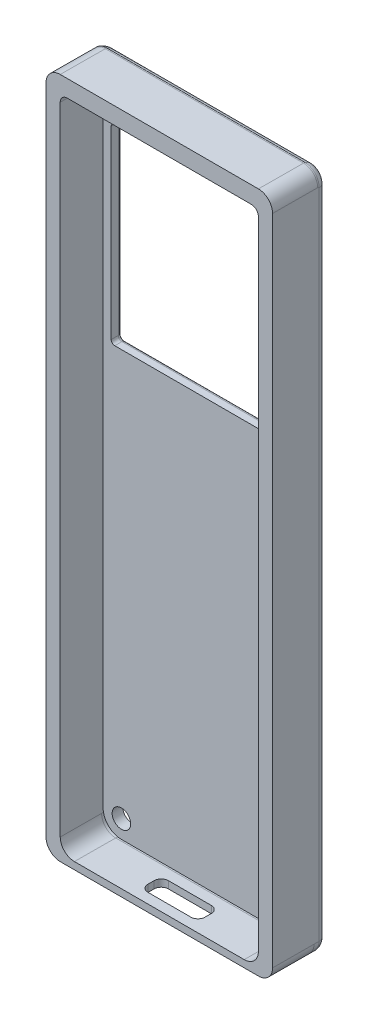
from build123d import *

# Parameters (mm, degrees)
BOSS_EXTRU_1_DEPTH      = 1.5
ESQUISSE2_R             = 1.304771715
ESQUISSE2_R_2           = 1.27
ENL_V_MAT_EXTRU_1_DEPTH = 10
ESQUISSE3_R             = 1.3
ENL_V_MAT_EXTRU_2_DEPTH = 10
BOSS_EXTRU_2_START      = -1
ESQUISSE4_R             = 1.3
ESQUISSE4_R_2           = 1.304771715
BOSS_EXTRU_2_DEPTH      = 1
ESQUISSE5_W             = 25.676080865
ESQUISSE5_H             = 27.053553015
ENL_V_MAT_EXTRU_3_DEPTH = 10
CONG_1_R                = 0.5
CONG_2_R                = 0.5
BOSS_EXTRU_3_REACH      = 171.856
BOSS_EXTRU_4_DEPTH      = 0.1
BOSS_EXTRU_5_REACH      = 171.861
CONG_3_R                = 1
ENL_V_MAT_EXTRU_4_DEPTH = 10


with BuildPart() as part:
    # Model → Boss.-Extru.1 (new body)
    with BuildSketch(Plane.XY):
        with BuildLine():
            Line((110.49, -34.813931), (110.49, -38.623931))
            Line((110.49, -38.623931), (110.49, -39.893931))
            Line((110.49, -39.893931), (110.49, -123.713931))
            add(Edge.make_bspline(
                [(109.746051, -125.509982), (110.222394, -125.03364), (110.49, -124.387581), (110.49, -123.713931)],
                knots=[0, 0, 0, 0, 1, 1, 1, 1], degree=3))
            add(Edge.make_bspline(
                [(107.95, -126.253931), (108.62365, -126.253931), (109.269709, -125.986325), (109.746051, -125.509982)],
                knots=[0, 0, 0, 0, 1, 1, 1, 1], degree=3))
            Line((107.95, -126.253931), (85.09, -126.253931))
            add(Edge.make_bspline(
                [(83.293949, -125.509982), (83.770291, -125.986325), (84.41635, -126.253931), (85.09, -126.253931)],
                knots=[0, 0, 0, 0, 1, 1, 1, 1], degree=3))
            add(Edge.make_bspline(
                [(82.55, -123.713931), (82.55, -124.387581), (82.817606, -125.03364), (83.293949, -125.509982)],
                knots=[0, 0, 0, 0, 1, 1, 1, 1], degree=3))
            Line((82.55, -123.713931), (82.55, -39.893931))
            Line((82.55, -39.893931), (82.55, -38.623931))
            Line((82.55, -38.623931), (82.55, -34.813931))
            add(Edge.make_bspline(
                [(82.921974, -33.915905), (82.683803, -34.154076), (82.55, -34.477106), (82.55, -34.813931)],
                knots=[0, 0, 0, 0, 1, 1, 1, 1], degree=3))
            add(Edge.make_bspline(
                [(83.82, -33.543931), (83.483175, -33.543931), (83.160146, -33.677734), (82.921974, -33.915905)],
                knots=[0, 0, 0, 0, 1, 1, 1, 1], degree=3))
            Line((83.82, -33.543931), (109.22, -33.543931))
            add(Edge.make_bspline(
                [(110.118026, -33.915905), (109.879854, -33.677734), (109.556825, -33.543931), (109.22, -33.543931)],
                knots=[0, 0, 0, 0, 1, 1, 1, 1], degree=3))
            add(Edge.make_bspline(
                [(110.49, -34.813931), (110.49, -34.477106), (110.356197, -34.154076), (110.118026, -33.915905)],
                knots=[0, 0, 0, 0, 1, 1, 1, 1], degree=3))
        make_face()
    extrude(amount=BOSS_EXTRU_1_DEPTH)

    # Esquisse2 → Enlèv. mat.-Extru.1 (cut)
    with BuildSketch(Plane.XY.offset(1.5)):
        with Locations((85.124771715, -123.713931)):
            Circle(ESQUISSE2_R)
        with Locations((107.95, -123.713931)):
            Circle(ESQUISSE2_R_2)
    extrude(amount=-ENL_V_MAT_EXTRU_1_DEPTH, mode=Mode.SUBTRACT)

    # Esquisse3 → Enlèv. mat.-Extru.2 (cut)
    with BuildSketch(Plane.XY.offset(1.5)):
        with Locations((107.943434753, -36.148574536)):
            Circle(ESQUISSE3_R)
        with Locations((85.084137325, -36.091280874)):
            Circle(ESQUISSE3_R)
    extrude(amount=-ENL_V_MAT_EXTRU_2_DEPTH, mode=Mode.SUBTRACT)

    # Esquisse4 → Boss.-Extru.2 (add)
    with BuildSketch(Plane(origin=(0, 0, 0), x_dir=(-1, 0, 0), z_dir=(0, 0, -1)).offset(BOSS_EXTRU_2_START)):
        with BuildLine():
            Line((-80.55, -33.263931), (-80.55, -125.263931))
            ThreePointArc((-80.55, -125.263931), (-81.135786438, -126.678144562), (-82.55, -127.263931))
            Line((-82.55, -127.263931), (-110.49, -127.263931))
            ThreePointArc((-110.49, -127.263931), (-111.904213562, -126.678144562), (-112.49, -125.263931))
            Line((-112.49, -125.263931), (-112.49, -33.263931))
            ThreePointArc((-112.49, -33.263931), (-111.904213562, -31.849717438), (-110.49, -31.263931))
            Line((-110.49, -31.263931), (-82.55, -31.263931))
            ThreePointArc((-82.55, -31.263931), (-81.135786438, -31.849717438), (-80.55, -33.263931))
        make_face()
        with Locations(Location((-107.943434753, -36.148574536, 0), (0, 0, 180))):
            Circle(ESQUISSE4_R, mode=Mode.SUBTRACT)
        with Locations(Location((-85.084137325, -36.091280874, 0), (0, 0, 180))):
            Circle(ESQUISSE4_R, mode=Mode.SUBTRACT)
        with Locations((-107.95, -123.713931)):
            Circle(ESQUISSE4_R, mode=Mode.SUBTRACT)
        with Locations(Location((-85.124771715, -123.713931, 0), (0, 0, 180))):
            Circle(ESQUISSE4_R_2, mode=Mode.SUBTRACT)
    extrude(amount=BOSS_EXTRU_2_DEPTH)

    # Esquisse5 → Enlèv. mat.-Extru.3 (cut)
    with BuildSketch(Plane(origin=(0, 0, 0), x_dir=(-1, 0, 0), z_dir=(0, 0, -1))):
        with Locations((-96.524770843, -52.916284218)):
            Rectangle(ESQUISSE5_W, ESQUISSE5_H)
    extrude(amount=-ENL_V_MAT_EXTRU_3_DEPTH, mode=Mode.SUBTRACT)

    # Congé1
    cong_1_edges = [part.edges().sort_by_distance(p)[0] for p in [
        (109.362811276, -66.443060725, 0.75),
        (109.362811276, -39.38950771, 0.75),
        (83.686730411, -39.38950771, 0.75),
        (83.686730411, -66.443060725, 0.75),
    ]]
    fillet(cong_1_edges, radius=CONG_1_R)

    # Congé2
    cong_2_edges = [part.edges().sort_by_distance(p)[0] for p in [
        (83.686730411, -52.916284217, 0),
        (96.524770843, -66.443060725, 0),
        (109.362811276, -52.916284217, 0),
        (96.524770843, -39.38950771, 0),
        (83.83317702, -66.296614115, 0),
        (109.216364666, -66.296614115, 0),
        (83.83317702, -39.53595432, 0),
        (109.216364666, -39.53595432, 0),
    ]]
    fillet(cong_2_edges, radius=CONG_2_R)

    # Boss.-Extru.3: up to this plane
    boss_extru_3_end = Plane(origin=(151.945719344, 11.006581477, 0.949399472), z_dir=(0, 0.00563171546098114, 0.9999841417647415))
    # Esquisse6 → Boss.-Extru.3 (add, up to the surface)
    with BuildSketch(Plane.XY.offset(1), mode=Mode.PRIVATE) as boss_extru_3_sk1:
        with BuildLine():
            Line((110.49, -31.152890146), (82.55, -31.152890146))
            ThreePointArc((82.55, -31.152890146), (81.135786438, -31.738676584), (80.55, -33.152890146))
            Line((80.55, -33.152890146), (80.55, -125.263931))
            ThreePointArc((80.55, -125.263931), (81.135786438, -126.678144562), (82.55, -127.263931))
            Line((82.55, -127.263931), (110.49, -127.263931))
            ThreePointArc((110.49, -127.263931), (111.904213562, -126.678144562), (112.49, -125.263931))
            Line((112.49, -125.263931), (112.49, -33.152890146))
            ThreePointArc((112.49, -33.152890146), (111.904213562, -31.738676584), (110.49, -31.152890146))
        make_face()
        with BuildLine():
            Line((109.49, -33.543931), (83.55, -33.543931))
            ThreePointArc((83.55, -33.543931), (82.842893219, -33.836824219), (82.55, -34.543931))
            Line((82.55, -34.543931), (82.55, -124.253931))
            ThreePointArc((82.55, -124.253931), (83.135786438, -125.668144562), (84.55, -126.253931))
            Line((84.55, -126.253931), (108.49, -126.253931))
            ThreePointArc((108.49, -126.253931), (109.904213562, -125.668144562), (110.49, -124.253931))
            Line((110.49, -124.253931), (110.49, -34.543931))
            ThreePointArc((110.49, -34.543931), (110.197106781, -33.836824219), (109.49, -33.543931))
        make_face(mode=Mode.SUBTRACT)
    boss_extru_3_tool1 = split(extrude(boss_extru_3_sk1.sketch, amount=BOSS_EXTRU_3_REACH, mode=Mode.PRIVATE), bisect_by=boss_extru_3_end, keep=Keep.BOTH, mode=Mode.PRIVATE)
    add(boss_extru_3_tool1.solids().sort_by_distance((96.52, -32.165683, 1))[0])

    # Esquisse8 → Boss.-Extru.4 (add)
    # profile 1 of 11: a face of its own
    with BuildSketch(Plane(origin=(0, 0, 0), x_dir=(-1, 0, 0), z_dir=(0, 0, -1))):
        Polygon((-106.7274706, -118.903119939), (-107.040908875, -118.903119939), (-107.076684624, -117.40801403), (-107.092169649, -116.871377801), (-107.203768626, -117.190689706), (-107.556720414, -118.151295253), (-107.778850434, -118.151295253), (-108.1099096, -117.226999421), (-108.219906678, -116.871377801), (-108.227382207, -117.433644417), (-108.271167452, -118.903119939), (-108.573926398, -118.903119939), (-108.456453791, -116.545124333), (-108.075735751, -116.545124333), (-107.758559711, -117.458206871), (-107.656038163, -117.766305481), (-107.555118514, -117.458206871), (-107.216583819, -116.545124333), (-106.825720417, -116.545124333), align=None)
    # profile 2 of 11: a face of its own
    with BuildSketch(Plane(origin=(0, 0, 0), x_dir=(-1, 0, 0), z_dir=(0, 0, -1))):
        with BuildLine():
            add(Edge.make_bspline(
                [(-104.717087119, -117.708637111), (-104.717973323, -117.759932969), (-104.719684596, -117.858985991), (-104.733780583, -118.00210291), (-104.75613314, -118.134577406), (-104.788745518, -118.256201652), (-104.82968214, -118.366950931), (-104.875882023, -118.46828329), (-104.929331795, -118.559391304), (-104.989204836, -118.640612659), (-105.055370399, -118.711245231), (-105.126089732, -118.773336103), (-105.203705016, -118.823782996), (-105.285420912, -118.865736696), (-105.371222576, -118.897596699), (-105.459543146, -118.920769872), (-105.550370869, -118.934285727), (-105.611615452, -118.936286459), (-105.642450883, -118.937293788)],
                knots=[0, 0, 0, 0, 1.423082774, 2.747992794, 3.986236128, 5.147128242, 6.236197569, 7.259302453, 8.233395673, 9.161912359, 10.053001658, 10.914402565, 11.766421957, 12.614596425, 13.458547256, 14.300675266, 15.144423756, 16, 16, 16, 16], degree=3))
            add(Edge.make_bspline(
                [(-105.642450883, -118.937293788), (-105.678820327, -118.936301062), (-105.749414471, -118.934374152), (-105.851677603, -118.918543), (-105.946771414, -118.893189924), (-106.03478415, -118.857208397), (-106.115027686, -118.810923688), (-106.188691252, -118.756039481), (-106.254604423, -118.691317795), (-106.31354804, -118.617816502), (-106.365061943, -118.535262828), (-106.409125711, -118.444174544), (-106.446586662, -118.344799531), (-106.476761918, -118.237201029), (-106.5000698, -118.121877477), (-106.516217849, -117.999302966), (-106.526737781, -117.869901201), (-106.527771485, -117.781278098), (-106.528301135, -117.735869397)],
                knots=[0, 0, 0, 0, 1.030115455, 1.999483942, 2.924432069, 3.813267415, 4.685316872, 5.542716903, 6.40939724, 7.295524004, 8.206506083, 9.160640047, 10.158252241, 11.211975818, 12.323750963, 13.4892538, 14.713543989, 16, 16, 16, 16], degree=3))
            add(Edge.make_bspline(
                [(-106.528301135, -117.735869397), (-106.527342849, -117.685114184), (-106.525490017, -117.586979601), (-106.512310078, -117.444856037), (-106.489638833, -117.313200606), (-106.457597105, -117.191936676), (-106.417461995, -117.08115519), (-106.370932574, -116.980166743), (-106.318462135, -116.888740986), (-106.258096455, -116.808151535), (-106.192022817, -116.737307321), (-106.121228503, -116.675393605), (-106.04430796, -116.624302361), (-105.963034704, -116.582406725), (-105.87751773, -116.550759341), (-105.789426583, -116.527393141), (-105.698751459, -116.51397278), (-105.63750933, -116.51196258), (-105.606675135, -116.510950484)],
                knots=[0, 0, 0, 0, 1.41309666, 2.732205102, 3.969807196, 5.128608405, 6.219709524, 7.24631839, 8.221244419, 9.148965463, 10.043106611, 10.914447659, 11.761129373, 12.607796584, 13.454637821, 14.294855332, 15.141493535, 16, 16, 16, 16], degree=3))
            add(Edge.make_bspline(
                [(-105.606675135, -116.510950484), (-105.570311777, -116.511973749), (-105.499553435, -116.513964889), (-105.397158122, -116.529416787), (-105.302158873, -116.555700263), (-105.214466557, -116.592191645), (-105.133822192, -116.638433659), (-105.06031483, -116.693706604), (-104.993764776, -116.757948396), (-104.935234932, -116.831577637), (-104.883088538, -116.913582734), (-104.837610616, -117.003772306), (-104.800602356, -117.103027178), (-104.769604142, -117.209920374), (-104.74595447, -117.324583201), (-104.728962319, -117.446395308), (-104.718702603, -117.575145541), (-104.717634463, -117.663408691), (-104.717087119, -117.708637111)],
                knots=[0, 0, 0, 0, 1.031800753, 2.007749398, 2.930678117, 3.822900438, 4.696376593, 5.562252438, 6.426830471, 7.314406963, 8.225311853, 9.18096675, 10.175487812, 11.227471919, 12.337140194, 13.495232744, 14.716489688, 16, 16, 16, 16], degree=3))
        make_face()
        with BuildLine():
            add(Edge.make_bspline(
                [(-105.058825612, -117.731597666), (-105.059342426, -117.697420919), (-105.060355144, -117.630450239), (-105.065140992, -117.532201597), (-105.075838982, -117.438587016), (-105.088656952, -117.349545514), (-105.106003142, -117.26558414), (-105.12858023, -117.187504846), (-105.15481233, -117.114985474), (-105.186996831, -117.049023604), (-105.223838826, -116.989621224), (-105.265044626, -116.936266326), (-105.312269553, -116.89098489), (-105.364080041, -116.852358718), (-105.421140006, -116.821570902), (-105.483944247, -116.799480835), (-105.5523991, -116.786640183), (-105.599856339, -116.785122738), (-105.624296026, -116.784341279)],
                knots=[0, 0, 0, 0, 1.323673599, 2.593790554, 3.807090586, 4.970987518, 6.076778004, 7.123914636, 8.116191169, 9.059475772, 9.960330598, 10.819370074, 11.662669578, 12.485668992, 13.315223066, 14.163241623, 15.054100047, 16, 16, 16, 16], degree=3))
            add(Edge.make_bspline(
                [(-105.624296026, -116.784341279), (-105.648022301, -116.785328797), (-105.694262926, -116.787253392), (-105.761352028, -116.800376834), (-105.82278306, -116.82434556), (-105.878941165, -116.856840282), (-105.929888479, -116.897099814), (-105.975337968, -116.945005311), (-106.017301598, -116.998246897), (-106.053669209, -117.0586763), (-106.084522833, -117.125098521), (-106.113021479, -117.196485788), (-106.135132929, -117.273967226), (-106.15469774, -117.356000534), (-106.168701111, -117.442241806), (-106.178629982, -117.531361124), (-106.18542878, -117.623098493), (-106.186180642, -117.685130147), (-106.186562641, -117.716646606)],
                knots=[0, 0, 0, 0, 0.938104053, 1.828290259, 2.688226573, 3.533173995, 4.38495139, 5.245952462, 6.138444459, 7.060521377, 8.026891732, 9.031849607, 10.096184638, 11.209149641, 12.36492099, 13.547735175, 14.754076334, 16, 16, 16, 16], degree=3))
            add(Edge.make_bspline(
                [(-106.186562641, -117.716646606), (-106.186142779, -117.751186029), (-106.185324072, -117.818536006), (-106.179221857, -117.917393631), (-106.170005302, -118.011532224), (-106.156142205, -118.100852546), (-106.13827359, -118.184566879), (-106.115826789, -118.262383655), (-106.089257937, -118.334312257), (-106.05804278, -118.400186866), (-106.021398332, -118.459345555), (-105.980554845, -118.512386765), (-105.933304026, -118.55714907), (-105.882743451, -118.596585947), (-105.825545494, -118.626644298), (-105.763390128, -118.648630866), (-105.695494363, -118.661660421), (-105.648560269, -118.663138729), (-105.624296026, -118.663902993)],
                knots=[0, 0, 0, 0, 1.340540585, 2.613980496, 3.843097936, 5.010722051, 6.120504555, 7.163418743, 8.151508278, 9.093960035, 9.987380757, 10.848401497, 11.683877306, 12.507385072, 13.329500698, 14.179475102, 15.05881515, 16, 16, 16, 16], degree=3))
            add(Edge.make_bspline(
                [(-105.624296026, -118.663902993), (-105.600548631, -118.663007986), (-105.554405284, -118.661268907), (-105.487803999, -118.646938667), (-105.42610608, -118.623962589), (-105.369675883, -118.591376301), (-105.318210564, -118.551152031), (-105.272165071, -118.503422931), (-105.230246619, -118.4498564), (-105.193446174, -118.38946367), (-105.16110685, -118.323440097), (-105.133287921, -118.251756787), (-105.109832374, -118.175025444), (-105.091586822, -118.092982883), (-105.076435635, -118.007149223), (-105.066799323, -117.917761649), (-105.059945755, -117.825682253), (-105.059202969, -117.76329309), (-105.058825612, -117.731597666)],
                knots=[0, 0, 0, 0, 0.936906737, 1.820494917, 2.676828052, 3.526792157, 4.383009914, 5.247809723, 6.13916262, 7.06372975, 8.034989121, 9.038664354, 10.096936984, 11.200050273, 12.355522744, 13.536827286, 14.74863997, 16, 16, 16, 16], degree=3))
        make_face(mode=Mode.SUBTRACT)
    # profile 3 of 11: a face of its own
    with BuildSketch(Plane(origin=(0, 0, 0), x_dir=(-1, 0, 0), z_dir=(0, 0, -1))):
        with BuildLine():
            Line((-102.735003856, -118.903119939), (-103.097033073, -118.903119939))
            Line((-103.097033073, -118.903119939), (-103.436101734, -118.166780278))
            add(Edge.make_bspline(
                [(-103.436101734, -118.166780278), (-103.448353709, -118.140674339), (-103.471082644, -118.09224458), (-103.511101792, -118.028652217), (-103.552550516, -117.977416075), (-103.597448894, -117.93802618), (-103.646431584, -117.909289447), (-103.6998089, -117.890697287), (-103.758355175, -117.879889712), (-103.799149565, -117.878587716), (-103.82055754, -117.877904458)],
                knots=[0, 0, 0, 0, 1.339134837, 2.484261414, 3.482991323, 4.391871607, 5.244507385, 6.105289549, 7.005698766, 8, 8, 8, 8], degree=3))
            Line((-103.82055754, -117.877904458), (-103.965262433, -117.877904458))
            Line((-103.965262433, -117.877904458), (-103.965262433, -118.903119939))
            Line((-103.965262433, -118.903119939), (-104.307000927, -118.903119939))
            Line((-104.307000927, -118.903119939), (-104.307000927, -116.545124333))
            Line((-104.307000927, -116.545124333), (-103.680124377, -116.545124333))
            add(Edge.make_bspline(
                [(-103.680124377, -116.545124333), (-103.647175533, -116.545551224), (-103.58364941, -116.54637428), (-103.491923742, -116.555050704), (-103.407370634, -116.569047536), (-103.33012045, -116.589525195), (-103.25964968, -116.614547384), (-103.195716824, -116.644449401), (-103.138313159, -116.679057937), (-103.087657987, -116.718546569), (-103.042877129, -116.761640536), (-103.005297417, -116.809911085), (-102.973430428, -116.861903323), (-102.948421069, -116.91841), (-102.929458174, -116.978315409), (-102.915303437, -117.041335568), (-102.907400955, -117.107543277), (-102.906387961, -117.152758064), (-102.905873103, -117.175738647)],
                knots=[0, 0, 0, 0, 1.390037284, 2.680023546, 3.883960013, 5.002565466, 6.047913656, 7.03574216, 7.976084698, 8.870016629, 9.741095147, 10.591561451, 11.444313202, 12.308368875, 13.191986167, 14.092206828, 15.030357037, 16, 16, 16, 16], degree=3))
            add(Edge.make_bspline(
                [(-102.905873103, -117.175738647), (-102.906299828, -117.194266936), (-102.907139036, -117.230705107), (-102.913307317, -117.284580468), (-102.922647141, -117.336975007), (-102.936641725, -117.387646073), (-102.954289554, -117.436396149), (-102.975602993, -117.483186645), (-103.001467244, -117.527500943), (-103.030744324, -117.569800653), (-103.06405647, -117.609402655), (-103.100846671, -117.646440402), (-103.141994725, -117.680044269), (-103.185911355, -117.711618064), (-103.233797749, -117.739554511), (-103.285169987, -117.76342455), (-103.33976665, -117.783958571), (-103.377802356, -117.794206216), (-103.397122188, -117.799411398)],
                knots=[0, 0, 0, 0, 1.032708305, 2.030948508, 3.019625047, 3.996933367, 4.957424013, 5.907556856, 6.85893238, 7.814077788, 8.77200233, 9.740252168, 10.719774328, 11.730219428, 12.753012585, 13.805036997, 14.885091985, 16, 16, 16, 16], degree=3))
            add(Edge.make_bspline(
                [(-103.397122188, -117.799411398), (-103.381419157, -117.805170922), (-103.350263296, -117.816598203), (-103.307426399, -117.842045509), (-103.267136699, -117.871624361), (-103.231902439, -117.90942604), (-103.197452701, -117.95200387), (-103.163304596, -118.001064798), (-103.128627713, -118.056429621), (-103.106790799, -118.096353097), (-103.095431174, -118.117121404)],
                knots=[0, 0, 0, 0, 0.890820497, 1.767447404, 2.649001527, 3.549193506, 4.515009134, 5.571837998, 6.736863216, 8, 8, 8, 8], degree=3))
            Line((-103.095431174, -118.117121404), (-102.735003856, -118.903119939))
        make_face()
        with BuildLine():
            add(Edge.make_bspline(
                [(-103.247611597, -117.198699202), (-103.2478616, -117.183198772), (-103.248345994, -117.15316598), (-103.253707439, -117.10969252), (-103.262881778, -117.069329593), (-103.275102823, -117.031927507), (-103.290371722, -116.997133872), (-103.310621918, -116.966147864), (-103.333478809, -116.937638608), (-103.359880656, -116.912352606), (-103.389614394, -116.890355675), (-103.422283739, -116.871237542), (-103.457585816, -116.854570623), (-103.495866099, -116.841119789), (-103.53707523, -116.831286059), (-103.581098333, -116.823619114), (-103.628075081, -116.819543005), (-103.660360788, -116.818863603), (-103.676920579, -116.818515128)],
                knots=[0, 0, 0, 0, 1.136086502, 2.201219443, 3.204852043, 4.166451082, 5.083443327, 5.98129036, 6.87199526, 7.758098985, 8.653381414, 9.577773354, 10.529401831, 11.511765708, 12.546811162, 13.632454437, 14.78565276, 16, 16, 16, 16], degree=3))
            Line((-103.676920579, -116.818515128), (-103.965262433, -116.818515128))
            Line((-103.965262433, -116.818515128), (-103.965262433, -117.604513663))
            Line((-103.965262433, -117.604513663), (-103.718035992, -117.604513663))
            add(Edge.make_bspline(
                [(-103.718035992, -117.604513663), (-103.70040781, -117.60419861), (-103.66597293, -117.603583185), (-103.615741009, -117.599018791), (-103.568418143, -117.590013906), (-103.523534793, -117.579364835), (-103.48174396, -117.564261641), (-103.44325952, -117.545989502), (-103.407433851, -117.525301617), (-103.375551145, -117.500462291), (-103.346319226, -117.473148575), (-103.320735139, -117.442655718), (-103.298479026, -117.409258647), (-103.280510266, -117.372501826), (-103.265165543, -117.333207592), (-103.255507971, -117.290540611), (-103.248702183, -117.245550799), (-103.247980981, -117.214567969), (-103.247611597, -117.198699202)],
                knots=[0, 0, 0, 0, 1.202615583, 2.349188572, 3.435207305, 4.486530095, 5.492783739, 6.45958443, 7.390413995, 8.308405015, 9.210274755, 10.115082188, 11.017605575, 11.940721498, 12.901403136, 13.887978084, 14.918265918, 16, 16, 16, 16], degree=3))
        make_face(mode=Mode.SUBTRACT)
    # profile 4 of 11: a face of its own
    with BuildSketch(Plane(origin=(0, 0, 0), x_dir=(-1, 0, 0), z_dir=(0, 0, -1))):
        with BuildLine():
            add(Edge.make_bspline(
                [(-100.787094443, -117.26277517), (-100.787671496, -117.286662222), (-100.788830791, -117.334651104), (-100.799533367, -117.406293022), (-100.816106249, -117.477551035), (-100.838872373, -117.547956571), (-100.868729297, -117.616469517), (-100.906038993, -117.681868638), (-100.951647519, -117.742925399), (-101.003240573, -117.800939683), (-101.062893975, -117.853962856), (-101.130322341, -117.901737196), (-101.205334691, -117.944269855), (-101.287705951, -117.982118357), (-101.378515906, -118.011819572), (-101.477512624, -118.033860045), (-101.58504789, -118.046462557), (-101.659562544, -118.047986669), (-101.698041115, -118.048773705)],
                knots=[0, 0, 0, 0, 0.84837333, 1.704374698, 2.568122001, 3.446177459, 4.329841521, 5.219461111, 6.115085959, 7.03322926, 7.973947317, 8.94447037, 9.964314875, 11.034235969, 12.160282575, 13.352588404, 14.632904974, 16, 16, 16, 16], degree=3))
            Line((-101.698041115, -118.048773705), (-101.98317917, -118.048773705))
            Line((-101.98317917, -118.048773705), (-101.98317917, -118.903119939))
            Line((-101.98317917, -118.903119939), (-102.324917664, -118.903119939))
            Line((-102.324917664, -118.903119939), (-102.324917664, -116.545124333))
            Line((-102.324917664, -116.545124333), (-101.665469165, -116.545124333))
            add(Edge.make_bspline(
                [(-101.665469165, -116.545124333), (-101.636793461, -116.545428032), (-101.579874842, -116.546030846), (-101.495600127, -116.554100669), (-101.412955245, -116.565468811), (-101.332613, -116.582463749), (-101.255467213, -116.604760217), (-101.182175586, -116.631975711), (-101.114762499, -116.667473107), (-101.051459666, -116.707250069), (-100.993159593, -116.75316763), (-100.941870853, -116.806454354), (-100.896636584, -116.865816475), (-100.857459781, -116.931114436), (-100.825203818, -117.003454505), (-100.803525355, -117.083606193), (-100.788972064, -117.170760752), (-100.787734991, -117.231384562), (-100.787094443, -117.26277517)],
                knots=[0, 0, 0, 0, 1.071095419, 2.126025337, 3.160633674, 4.187194637, 5.191188192, 6.159546808, 7.102471747, 8.032359578, 8.950543616, 9.867691343, 10.788184798, 11.733733012, 12.707489344, 13.737062018, 14.82826569, 16, 16, 16, 16], degree=3))
        make_face()
        with BuildLine():
            add(Edge.make_bspline(
                [(-101.128832937, -117.280930027), (-101.12917383, -117.26275083), (-101.129838245, -117.227318897), (-101.136980352, -117.176006529), (-101.148227151, -117.127907754), (-101.163546919, -117.083064255), (-101.183406884, -117.041342548), (-101.208239381, -117.003313356), (-101.237257648, -116.968182954), (-101.270953323, -116.936779885), (-101.308664349, -116.909137286), (-101.349258743, -116.884150077), (-101.39404529, -116.863958261), (-101.442407784, -116.847589722), (-101.494079143, -116.833982688), (-101.549560356, -116.825419538), (-101.608187398, -116.819061494), (-101.648541165, -116.818700169), (-101.66920693, -116.818515128)],
                knots=[0, 0, 0, 0, 1.07893025, 2.102875295, 3.069403633, 4.00867391, 4.911619206, 5.805799344, 6.69897942, 7.61127936, 8.532960211, 9.47193309, 10.436783978, 11.442898866, 12.50165651, 13.605056338, 14.773513735, 16, 16, 16, 16], degree=3))
            Line((-101.66920693, -116.818515128), (-101.98317917, -116.818515128))
            Line((-101.98317917, -116.818515128), (-101.98317917, -117.77538291))
            Line((-101.98317917, -117.77538291), (-101.696439216, -117.77538291))
            add(Edge.make_bspline(
                [(-101.696439216, -117.77538291), (-101.674358783, -117.774903991), (-101.631556628, -117.773975623), (-101.569078835, -117.76877243), (-101.510444058, -117.759413572), (-101.455918111, -117.745335439), (-101.405266263, -117.728338417), (-101.35839808, -117.707576016), (-101.315555203, -117.682289164), (-101.27640127, -117.653466655), (-101.241206277, -117.620832055), (-101.21131346, -117.583507568), (-101.185444263, -117.542794003), (-101.164416766, -117.497953903), (-101.14867792, -117.449070519), (-101.136863575, -117.396556925), (-101.129838661, -117.340034991), (-101.129175519, -117.301063119), (-101.128832937, -117.280930027)],
                knots=[0, 0, 0, 0, 1.232805628, 2.389751021, 3.4973379, 4.54330244, 5.530003372, 6.477393866, 7.399377973, 8.301660217, 9.187431021, 10.070466494, 10.963674817, 11.874940633, 12.827061481, 13.825105319, 14.876436953, 16, 16, 16, 16], degree=3))
        make_face(mode=Mode.SUBTRACT)
    # profile 5 of 11: a face of its own
    with BuildSketch(Plane(origin=(0, 0, 0), x_dir=(-1, 0, 0), z_dir=(0, 0, -1))):
        Polygon((-98.736663482, -118.903119939), (-99.078401975, -118.903119939), (-99.078401975, -117.809556759), (-100.035269757, -117.809556759), (-100.035269757, -118.903119939), (-100.377008251, -118.903119939), (-100.377008251, -116.545124333), (-100.035269757, -116.545124333), (-100.035269757, -117.536165965), (-99.078401975, -117.536165965), (-99.078401975, -116.545124333), (-98.736663482, -116.545124333), align=None)
    # profile 6 of 11: a face of its own
    with BuildSketch(Plane(origin=(0, 0, 0), x_dir=(-1, 0, 0), z_dir=(0, 0, -1))):
        Polygon((-96.857101767, -118.903119939), (-98.189881892, -118.903119939), (-98.189881892, -116.545124333), (-96.857101767, -116.545124333), (-96.857101767, -116.818515128), (-97.848143399, -116.818515128), (-97.848143399, -117.536165965), (-96.896615281, -117.536165965), (-96.896615281, -117.809556759), (-97.848143399, -117.809556759), (-97.848143399, -118.629729144), (-96.857101767, -118.629729144), align=None)
    # profile 7 of 11: a face of its own
    with BuildSketch(Plane(origin=(0, 0, 0), x_dir=(-1, 0, 0), z_dir=(0, 0, -1))):
        with BuildLine():
            add(Edge.make_bspline(
                [(-94.738323107, -118.265030095), (-94.739090488, -118.292314491), (-94.740579195, -118.345245759), (-94.75367723, -118.422266871), (-94.775520617, -118.49380781), (-94.805536912, -118.560358288), (-94.84415075, -118.620709646), (-94.888256493, -118.677039631), (-94.940922443, -118.726587726), (-94.999267513, -118.771703582), (-95.064203022, -118.811408664), (-95.135895131, -118.844824119), (-95.213361032, -118.873692056), (-95.296815949, -118.896968347), (-95.385513674, -118.915062517), (-95.479016392, -118.927492615), (-95.576854327, -118.935882067), (-95.643555916, -118.936817016), (-95.677569998, -118.937293788)],
                knots=[0, 0, 0, 0, 1.005643061, 1.95093061, 2.870738502, 3.757832008, 4.633806625, 5.507195241, 6.389247641, 7.292512577, 8.223494331, 9.189475669, 10.205094408, 11.269007441, 12.381228937, 13.540657028, 14.745872513, 16, 16, 16, 16], degree=3))
            add(Edge.make_bspline(
                [(-95.677569998, -118.937293788), (-95.708900295, -118.936942748), (-95.771410879, -118.936242348), (-95.864369243, -118.931948591), (-95.9553125, -118.924855458), (-96.042881685, -118.916326013), (-96.126413136, -118.906844423), (-96.20480024, -118.895878757), (-96.27705424, -118.883128265), (-96.322801782, -118.873507836), (-96.344494027, -118.868946089)],
                knots=[0, 0, 0, 0, 1.119729043, 2.234096861, 3.324996266, 4.379512959, 5.378439906, 6.329323539, 7.207810484, 8, 8, 8, 8], degree=3))
            Line((-96.344494027, -118.868946089), (-96.344494027, -118.561381445))
            add(Edge.make_bspline(
                [(-96.344494027, -118.561381445), (-96.321269705, -118.569338803), (-96.273816565, -118.585597691), (-96.199381894, -118.604667889), (-96.121302363, -118.622577754), (-96.038836033, -118.637540331), (-95.951179482, -118.649316611), (-95.857998273, -118.657598726), (-95.75897938, -118.663207307), (-95.691105395, -118.663666779), (-95.656211342, -118.663902993)],
                knots=[0, 0, 0, 0, 0.842364813, 1.72116351, 2.635659137, 3.591954833, 4.596841017, 5.670471508, 6.802388115, 8, 8, 8, 8], degree=3))
            add(Edge.make_bspline(
                [(-95.656211342, -118.663902993), (-95.631281221, -118.663646361), (-95.58332922, -118.663152739), (-95.514232829, -118.657992045), (-95.450782991, -118.651263804), (-95.393116393, -118.639577408), (-95.34065428, -118.626126271), (-95.293235141, -118.609009231), (-95.25093379, -118.588638959), (-95.213012287, -118.565802966), (-95.18051273, -118.539418023), (-95.152019213, -118.510982991), (-95.129153077, -118.479262339), (-95.110578742, -118.445008855), (-95.096847717, -118.408106701), (-95.087312379, -118.368653316), (-95.081314055, -118.326796678), (-95.080486456, -118.297978829), (-95.080061601, -118.283184953)],
                knots=[0, 0, 0, 0, 1.523194236, 2.929797672, 4.233142745, 5.41923506, 6.522104548, 7.540643951, 8.494207191, 9.387815665, 10.238903194, 11.04655015, 11.840679357, 12.619387111, 13.4214478, 14.239285369, 15.096122854, 16, 16, 16, 16], degree=3))
            add(Edge.make_bspline(
                [(-95.080061601, -118.283184953), (-95.08059181, -118.267813348), (-95.081627728, -118.237780466), (-95.092208916, -118.194693797), (-95.108752531, -118.154737709), (-95.13300631, -118.119102849), (-95.161508697, -118.085620869), (-95.194992508, -118.054940729), (-95.231953948, -118.025273674), (-95.288037173, -117.987966032), (-95.366513166, -117.94412806), (-95.471052071, -117.900289398), (-95.581909179, -117.856272731), (-95.695678364, -117.810363126), (-95.809418543, -117.761629899), (-95.921002138, -117.710002251), (-96.025654785, -117.650774621), (-96.10446009, -117.592004939), (-96.159519164, -117.539084748), (-96.196976637, -117.496712007), (-96.229116756, -117.450441327), (-96.258807014, -117.401909161), (-96.282035487, -117.34827586), (-96.298151451, -117.290045409), (-96.30884657, -117.227210509), (-96.309817557, -117.183795087), (-96.310320178, -117.161321554)],
                knots=[0, 0, 0, 0, 0.619815692, 1.2109895, 1.781199776, 2.357496674, 2.943929778, 3.554333405, 4.188738872, 4.856760597, 6.272963823, 7.811824644, 9.431291666, 11.092170587, 12.76691914, 14.429617761, 16.056218893, 17.616396577, 18.384212937, 19.138341755, 19.896401647, 20.65718422, 21.4332038, 22.247956952, 23.09307348, 24, 24, 24, 24], degree=3))
            add(Edge.make_bspline(
                [(-96.310320178, -117.161321554), (-96.309707538, -117.141170079), (-96.308480754, -117.100817616), (-96.298346751, -117.040521506), (-96.282408543, -116.980752239), (-96.259970157, -116.921727204), (-96.230578714, -116.864812473), (-96.19480856, -116.810248647), (-96.150871974, -116.760011166), (-96.100491183, -116.712641267), (-96.042204936, -116.669301087), (-95.976741717, -116.629765066), (-95.903036519, -116.595835619), (-95.822500247, -116.565045526), (-95.733509295, -116.540604603), (-95.636504884, -116.523094537), (-95.53146803, -116.513211975), (-95.458842416, -116.5117216), (-95.421266128, -116.510950484)],
                knots=[0, 0, 0, 0, 0.784067079, 1.570060577, 2.373452904, 3.189297991, 4.022898002, 4.862695015, 5.722463422, 6.614650011, 7.550049647, 8.544652583, 9.586108202, 10.704431291, 11.897970904, 13.172772987, 14.537200697, 16, 16, 16, 16], degree=3))
            add(Edge.make_bspline(
                [(-95.421266128, -116.510950484), (-95.400255507, -116.51108661), (-95.356590195, -116.511369515), (-95.289309584, -116.516206158), (-95.219135008, -116.522306087), (-95.147778552, -116.531044288), (-95.0765413, -116.541020018), (-95.006604624, -116.552781293), (-94.939468428, -116.56533413), (-94.896001468, -116.574751906), (-94.875018505, -116.579298183)],
                knots=[0, 0, 0, 0, 0.91416123, 1.89985515, 2.934260182, 3.979599391, 5.027947684, 6.064525625, 7.065681407, 8, 8, 8, 8], degree=3))
            Line((-94.875018505, -116.579298183), (-94.875018505, -116.852688978))
            add(Edge.make_bspline(
                [(-94.875018505, -116.852688978), (-94.921722918, -116.842330248), (-95.01466851, -116.821715532), (-95.154551734, -116.801151344), (-95.291925104, -116.786749849), (-95.382607099, -116.785134536), (-95.427139758, -116.784341279)],
                knots=[0, 0, 0, 0, 1.029411825, 2.048613503, 3.041701399, 4, 4, 4, 4], degree=3))
            add(Edge.make_bspline(
                [(-95.427139758, -116.784341279), (-95.449571936, -116.784684161), (-95.493054285, -116.785348801), (-95.556004778, -116.789435218), (-95.614292166, -116.796918211), (-95.66797567, -116.807038931), (-95.717203648, -116.819563473), (-95.761824594, -116.835475358), (-95.801592681, -116.854897911), (-95.837177022, -116.876720378), (-95.868055171, -116.901424546), (-95.895199601, -116.927651213), (-95.917862249, -116.956169858), (-95.936155813, -116.986975396), (-95.950471987, -117.019658252), (-95.961590253, -117.054081757), (-95.967233196, -117.090830245), (-95.968125381, -117.115918414), (-95.968581684, -117.128749604)],
                knots=[0, 0, 0, 0, 1.491437277, 2.890989782, 4.191431573, 5.395946596, 6.521058188, 7.565423013, 8.539223212, 9.458660202, 10.334655275, 11.163081303, 11.963306063, 12.748694206, 13.538083787, 14.331542868, 15.146677777, 16, 16, 16, 16], degree=3))
            add(Edge.make_bspline(
                [(-95.968581684, -117.128749604), (-95.968052071, -117.144119706), (-95.967017318, -117.174149653), (-95.956388417, -117.217417635), (-95.939756353, -117.257486076), (-95.916502479, -117.2942332), (-95.886880401, -117.326984226), (-95.854277271, -117.35884223), (-95.817184943, -117.388729775), (-95.761211641, -117.426997304), (-95.682043257, -117.470606885), (-95.578016743, -117.516361417), (-95.466544861, -117.559123783), (-95.353044272, -117.60548361), (-95.23889572, -117.653709856), (-95.145864572, -117.69857404), (-95.073663, -117.737086281), (-95.02306488, -117.7693712), (-94.975021803, -117.803421281), (-94.930846144, -117.841039262), (-94.889390297, -117.880826189), (-94.8523321, -117.92455932), (-94.819274755, -117.971286299), (-94.790770916, -118.02147719), (-94.766390656, -118.075233982), (-94.750492156, -118.134376576), (-94.739792487, -118.198073434), (-94.738824136, -118.242199225), (-94.738323107, -118.265030095)],
                knots=[0, 0, 0, 0, 0.667485538, 1.304126353, 1.925325377, 2.548259058, 3.18485279, 3.841928735, 4.529978862, 5.253739616, 6.789399884, 8.452896455, 10.194043647, 11.982660287, 13.786213269, 15.583473082, 16.473910229, 17.343881083, 18.192645259, 19.033319022, 19.865571682, 20.689426309, 21.522902605, 22.351690537, 23.197589349, 24.082454772, 25.007853999, 26, 26, 26, 26], degree=3))
        make_face()
    # profile 8 of 11: a face of its own
    with BuildSketch(Plane(origin=(0, 0, 0), x_dir=(-1, 0, 0), z_dir=(0, 0, -1))):
        with BuildLine():
            add(Edge.make_bspline(
                [(-92.722065995, -117.26277517), (-92.722643049, -117.286662222), (-92.723802343, -117.334651104), (-92.73450492, -117.406293022), (-92.751077801, -117.477551035), (-92.773843925, -117.547956571), (-92.803700849, -117.616469517), (-92.841010546, -117.681868638), (-92.886619071, -117.742925399), (-92.938212125, -117.800939683), (-92.997865527, -117.853962856), (-93.065293893, -117.901737196), (-93.140306243, -117.944269855), (-93.222677504, -117.982118357), (-93.313487458, -118.011819572), (-93.412484177, -118.033860045), (-93.520019442, -118.046462557), (-93.594534097, -118.047986669), (-93.633012667, -118.048773705)],
                knots=[0, 0, 0, 0, 0.84837333, 1.704374698, 2.568122001, 3.446177459, 4.329841521, 5.219461111, 6.115085959, 7.03322926, 7.973947317, 8.94447037, 9.964314875, 11.034235969, 12.160282575, 13.352588404, 14.632904974, 16, 16, 16, 16], degree=3))
            Line((-93.633012667, -118.048773705), (-93.918150723, -118.048773705))
            Line((-93.918150723, -118.048773705), (-93.918150723, -118.903119939))
            Line((-93.918150723, -118.903119939), (-94.259889216, -118.903119939))
            Line((-94.259889216, -118.903119939), (-94.259889216, -116.545124333))
            Line((-94.259889216, -116.545124333), (-93.600440717, -116.545124333))
            add(Edge.make_bspline(
                [(-93.600440717, -116.545124333), (-93.571765014, -116.545428032), (-93.514846395, -116.546030846), (-93.43057168, -116.554100669), (-93.347926798, -116.565468811), (-93.267584552, -116.582463749), (-93.190438766, -116.604760217), (-93.117147139, -116.631975711), (-93.049734052, -116.667473107), (-92.986431218, -116.707250069), (-92.928131145, -116.75316763), (-92.876842405, -116.806454354), (-92.831608136, -116.865816475), (-92.792431333, -116.931114436), (-92.760175371, -117.003454505), (-92.738496908, -117.083606193), (-92.723943616, -117.170760752), (-92.722706543, -117.231384562), (-92.722065995, -117.26277517)],
                knots=[0, 0, 0, 0, 1.071095419, 2.126025337, 3.160633674, 4.187194637, 5.191188192, 6.159546808, 7.102471747, 8.032359578, 8.950543616, 9.867691343, 10.788184798, 11.733733012, 12.707489344, 13.737062018, 14.82826569, 16, 16, 16, 16], degree=3))
        make_face()
        with BuildLine():
            add(Edge.make_bspline(
                [(-93.063804489, -117.280930027), (-93.064145383, -117.26275083), (-93.064809797, -117.227318897), (-93.071951904, -117.176006529), (-93.083198704, -117.127907754), (-93.098518471, -117.083064255), (-93.118378436, -117.041342548), (-93.143210933, -117.003313356), (-93.1722292, -116.968182954), (-93.205924875, -116.936779885), (-93.243635901, -116.909137286), (-93.284230295, -116.884150077), (-93.329016842, -116.863958261), (-93.377379337, -116.847589722), (-93.429050696, -116.833982688), (-93.484531909, -116.825419538), (-93.54315895, -116.819061494), (-93.583512718, -116.818700169), (-93.604178482, -116.818515128)],
                knots=[0, 0, 0, 0, 1.07893025, 2.102875295, 3.069403633, 4.00867391, 4.911619206, 5.805799344, 6.69897942, 7.61127936, 8.532960211, 9.47193309, 10.436783978, 11.442898866, 12.50165651, 13.605056338, 14.773513735, 16, 16, 16, 16], degree=3))
            Line((-93.604178482, -116.818515128), (-93.918150723, -116.818515128))
            Line((-93.918150723, -116.818515128), (-93.918150723, -117.77538291))
            Line((-93.918150723, -117.77538291), (-93.631410768, -117.77538291))
            add(Edge.make_bspline(
                [(-93.631410768, -117.77538291), (-93.609330335, -117.774903991), (-93.566528181, -117.773975623), (-93.504050388, -117.76877243), (-93.445415611, -117.759413572), (-93.390889663, -117.745335439), (-93.340237815, -117.728338417), (-93.293369632, -117.707576016), (-93.250526756, -117.682289164), (-93.211372823, -117.653466655), (-93.176177829, -117.620832055), (-93.146285012, -117.583507568), (-93.120415815, -117.542794003), (-93.099388318, -117.497953903), (-93.083649472, -117.449070519), (-93.071835128, -117.396556925), (-93.064810214, -117.340034991), (-93.064147072, -117.301063119), (-93.063804489, -117.280930027)],
                knots=[0, 0, 0, 0, 1.232805628, 2.389751021, 3.4973379, 4.54330244, 5.530003372, 6.477393866, 7.399377973, 8.301660217, 9.187431021, 10.070466494, 10.963674817, 11.874940633, 12.827061481, 13.825105319, 14.876436953, 16, 16, 16, 16], degree=3))
        make_face(mode=Mode.SUBTRACT)
    # profile 9 of 11: a face of its own
    with BuildSketch(Plane(origin=(0, 0, 0), x_dir=(-1, 0, 0), z_dir=(0, 0, -1))):
        with BuildLine():
            Line((-88.689551772, -118.903119939), (-90.227374992, -118.903119939))
            Line((-90.227374992, -118.903119939), (-90.227374992, -118.613176186))
            Line((-90.227374992, -118.613176186), (-89.63360436, -118.012997956))
            add(Edge.make_bspline(
                [(-89.63360436, -118.012997956), (-89.610451422, -117.989340801), (-89.566079109, -117.944002161), (-89.502631903, -117.878697876), (-89.447238972, -117.816977701), (-89.39771788, -117.76019387), (-89.353835809, -117.707093949), (-89.316118633, -117.656209107), (-89.282525112, -117.608335699), (-89.254887811, -117.562032739), (-89.230645572, -117.517984472), (-89.211999302, -117.474833292), (-89.195573825, -117.433495115), (-89.181862209, -117.378512727), (-89.170076393, -117.307769598), (-89.168695659, -117.250196741), (-89.167985662, -117.220591824)],
                knots=[0, 0, 0, 0, 1.467801241, 2.813022554, 4.036721291, 5.144444768, 6.153968288, 7.089984895, 7.95251278, 8.745669366, 9.480110839, 10.179673505, 10.829044045, 11.449272791, 12.688373796, 14, 14, 14, 14], degree=3))
            add(Edge.make_bspline(
                [(-89.167985662, -117.220591824), (-89.169099028, -117.192022453), (-89.17129073, -117.135782554), (-89.18618725, -117.067337521), (-89.202919514, -117.015447619), (-89.219668078, -116.9793357), (-89.238956345, -116.945262235), (-89.261428567, -116.913717138), (-89.286886091, -116.884717416), (-89.31643252, -116.859196806), (-89.349361902, -116.836897434), (-89.386087157, -116.818006419), (-89.426455891, -116.803163875), (-89.470388351, -116.791763526), (-89.518265506, -116.785508438), (-89.551356287, -116.784738994), (-89.56846046, -116.784341279)],
                knots=[0, 0, 0, 0, 1.786063733, 3.515934619, 4.361143923, 5.193414643, 6.001490655, 6.8080304, 7.612645686, 8.409905662, 9.243888339, 10.095602441, 10.987157488, 11.929830611, 12.929957752, 14, 14, 14, 14], degree=3))
            add(Edge.make_bspline(
                [(-89.56846046, -116.784341279), (-89.59236179, -116.785192013), (-89.639593931, -116.786873174), (-89.708748185, -116.799323138), (-89.774687426, -116.820228609), (-89.836635657, -116.850085576), (-89.895389833, -116.886378826), (-89.952074071, -116.926905012), (-90.006505829, -116.972470066), (-90.040037959, -117.00636999), (-90.057039712, -117.023558224)],
                knots=[0, 0, 0, 0, 1.023997976, 2.023553336, 3.000587663, 3.979882544, 4.962380846, 5.957326575, 6.964305914, 8, 8, 8, 8], degree=3))
            Line((-90.057039712, -117.023558224), (-90.227374992, -116.817981162))
            add(Edge.make_bspline(
                [(-90.227374992, -116.817981162), (-90.205013413, -116.795452109), (-90.160429746, -116.750534538), (-90.086161256, -116.691468162), (-90.007407263, -116.638929123), (-89.923689107, -116.592904461), (-89.833545861, -116.555523915), (-89.736073626, -116.529609382), (-89.631799967, -116.513930754), (-89.559973494, -116.511961943), (-89.523073316, -116.510950484)],
                knots=[0, 0, 0, 0, 0.961904287, 1.917808245, 2.871393154, 3.830279184, 4.810558542, 5.822670133, 6.881417188, 8, 8, 8, 8], degree=3))
            add(Edge.make_bspline(
                [(-89.523073316, -116.510950484), (-89.497764242, -116.511329224), (-89.44821872, -116.512070654), (-89.375784847, -116.521825348), (-89.306429065, -116.53569546), (-89.241020511, -116.556822283), (-89.179091806, -116.582459772), (-89.121339836, -116.613103555), (-89.068483105, -116.650101626), (-89.01989845, -116.691652213), (-88.975629653, -116.738253595), (-88.937312559, -116.790573527), (-88.903270868, -116.847171749), (-88.875875569, -116.909039239), (-88.852886506, -116.974747363), (-88.83804906, -117.045113185), (-88.827900331, -117.119198746), (-88.826807106, -117.170006334), (-88.826247169, -117.19602937)],
                knots=[0, 0, 0, 0, 1.101119101, 2.155571603, 3.176926796, 4.176889981, 5.142604225, 6.092612713, 7.016989052, 7.945805093, 8.872290513, 9.808448578, 10.764035296, 11.742108021, 12.749341803, 13.789111775, 14.867609617, 16, 16, 16, 16], degree=3))
            add(Edge.make_bspline(
                [(-88.826247169, -117.19602937), (-88.826660143, -117.218113503), (-88.827474554, -117.261664804), (-88.833833044, -117.325792079), (-88.845130077, -117.387342471), (-88.860674863, -117.44661304), (-88.880987745, -117.504411396), (-88.904687258, -117.562091849), (-88.933960634, -117.619253177), (-88.967117504, -117.67676288), (-89.005470647, -117.734296877), (-89.047375007, -117.793417268), (-89.095519514, -117.852355497), (-89.147148559, -117.91356092), (-89.204428985, -117.975827065), (-89.265036305, -118.04191654), (-89.331517273, -118.110038274), (-89.377615219, -118.156320752), (-89.401328978, -118.180129438)],
                knots=[0, 0, 0, 0, 0.902990484, 1.780754108, 2.631610674, 3.459590136, 4.283625367, 5.135197631, 6.007543003, 6.907624824, 7.848341594, 8.83404703, 9.869576246, 10.959028296, 12.108116138, 13.328740157, 14.625847426, 16, 16, 16, 16], degree=3))
            Line((-89.401328978, -118.180129438), (-89.8172888, -118.595555295))
            Line((-89.8172888, -118.595555295), (-88.689551772, -118.595555295))
            Line((-88.689551772, -118.595555295), (-88.689551772, -118.903119939))
        make_face()
    # profile 10 of 11: a face of its own
    with BuildSketch(Plane(origin=(0, 0, 0), x_dir=(-1, 0, 0), z_dir=(0, 0, -1))):
        Polygon((-86.570773112, -118.390512198), (-86.946685454, -118.390512198), (-86.946685454, -118.903119939), (-87.288423948, -118.903119939), (-87.288423948, -118.390512198), (-88.416160977, -118.390512198), (-88.416160977, -118.117121404), (-87.418177782, -116.545124333), (-86.946685454, -116.545124333), (-86.946685454, -118.117121404), (-86.570773112, -118.117121404), align=None)
        Polygon((-87.288423948, -116.849485179), (-88.102722702, -118.117121404), (-87.288423948, -118.117121404), align=None, mode=Mode.SUBTRACT)
    # profile 11 of 11: a face of its own
    with BuildSketch(Plane(origin=(0, 0, 0), x_dir=(-1, 0, 0), z_dir=(0, 0, -1))):
        with BuildLine():
            add(Edge.make_bspline(
                [(-84.554516, -117.725190069), (-84.555003088, -117.769356563), (-84.555957178, -117.855868184), (-84.56717006, -117.982414661), (-84.583919598, -118.103199377), (-84.60784089, -118.217767328), (-84.638193383, -118.325724132), (-84.677160938, -118.425759298), (-84.722110099, -118.518308611), (-84.774622471, -118.60269037), (-84.833998552, -118.678333026), (-84.900283508, -118.745398625), (-84.973586631, -118.803238853), (-85.053928224, -118.851647835), (-85.141008544, -118.890766872), (-85.235830403, -118.917473092), (-85.337576129, -118.934654449), (-85.407898764, -118.936396765), (-85.444104016, -118.937293788)],
                knots=[0, 0, 0, 0, 1.248871528, 2.446241243, 3.590357027, 4.69618527, 5.754202854, 6.758290001, 7.728669934, 8.660396172, 9.563796911, 10.443071522, 11.321307858, 12.197637495, 13.090115231, 14.012601613, 14.976798049, 16, 16, 16, 16], degree=3))
            add(Edge.make_bspline(
                [(-85.444104016, -118.937293788), (-85.475476099, -118.936530093), (-85.537268923, -118.935025861), (-85.627726108, -118.921457479), (-85.713731311, -118.898812338), (-85.795440705, -118.868152585), (-85.871873737, -118.827162132), (-85.94262788, -118.776630408), (-86.008006473, -118.716803296), (-86.066892168, -118.646630818), (-86.119869415, -118.566826131), (-86.165825804, -118.476517846), (-86.205557917, -118.376542561), (-86.239478611, -118.266487378), (-86.265079892, -118.145811678), (-86.284312603, -118.014940724), (-86.295380316, -117.873467806), (-86.29669956, -117.775758307), (-86.297382317, -117.725190069)],
                knots=[0, 0, 0, 0, 0.897102697, 1.767001224, 2.609309556, 3.43771295, 4.257811968, 5.082953918, 5.919052252, 6.786174452, 7.6970727, 8.653553743, 9.679470751, 10.771494031, 11.944028827, 13.204944144, 14.553456404, 16, 16, 16, 16], degree=3))
            add(Edge.make_bspline(
                [(-86.297382317, -117.725190069), (-86.296586427, -117.681032236), (-86.295024614, -117.59437923), (-86.285092198, -117.467356992), (-86.267393073, -117.346279635), (-86.243093301, -117.231493387), (-86.211754083, -117.123407569), (-86.173472879, -117.022971002), (-86.128565145, -116.93039129), (-86.076634747, -116.845896048), (-86.017522631, -116.769958019), (-85.951055313, -116.702875576), (-85.877702596, -116.644843103), (-85.796873217, -116.59660575), (-85.709425895, -116.557571331), (-85.614637392, -116.530826167), (-85.51343489, -116.513611045), (-85.443643767, -116.511853354), (-85.407794301, -116.510950484)],
                knots=[0, 0, 0, 0, 1.248165713, 2.449334701, 3.598380242, 4.704508407, 5.763215836, 6.776019403, 7.739017366, 8.667464557, 9.574217704, 10.452902578, 11.330549874, 12.210601904, 13.107080692, 14.028948355, 14.987533857, 16, 16, 16, 16], degree=3))
            add(Edge.make_bspline(
                [(-85.407794301, -116.510950484), (-85.376421479, -116.511714178), (-85.314627201, -116.513218408), (-85.22435124, -116.5267612), (-85.138406687, -116.549351601), (-85.057024039, -116.580919187), (-84.980173675, -116.62126256), (-84.909607792, -116.672357165), (-84.844403521, -116.732516926), (-84.785673624, -116.803155776), (-84.732502159, -116.883249576), (-84.68612371, -116.973366272), (-84.646770615, -117.073709462), (-84.613263416, -117.183646344), (-84.58653945, -117.304112057), (-84.567662481, -117.434922176), (-84.556482338, -117.576551255), (-84.555187343, -117.674442114), (-84.554516, -117.725190069)],
                knots=[0, 0, 0, 0, 0.896490568, 1.765795528, 2.602608418, 3.432274242, 4.256303472, 5.076742829, 5.915718828, 6.786140009, 7.696416714, 8.659101079, 9.677705081, 10.773848187, 11.941709476, 13.20176442, 14.549356535, 16, 16, 16, 16], degree=3))
        make_face()
        with BuildLine():
            add(Edge.make_bspline(
                [(-84.896254493, -117.743344926), (-84.896375209, -117.72286701), (-84.896615799, -117.682054087), (-84.901164184, -117.621235966), (-84.904966127, -117.561205354), (-84.908785867, -117.521562764), (-84.910671586, -117.501992115)],
                knots=[0, 0, 0, 0, 1.015676625, 2.024265076, 3.024624451, 4, 4, 4, 4], degree=3))
            Line((-84.910671586, -117.501992115), (-85.888898024, -118.253816801))
            add(Edge.make_bspline(
                [(-85.888898024, -118.253816801), (-85.879268779, -118.282664443), (-85.8603819, -118.339246446), (-85.823934969, -118.419013919), (-85.779261205, -118.490257448), (-85.725557186, -118.550910989), (-85.66311601, -118.599619829), (-85.604969951, -118.63070062), (-85.554248945, -118.647500929), (-85.513596983, -118.657404812), (-85.470213796, -118.662422429), (-85.440554385, -118.663402653), (-85.425415192, -118.663902993)],
                knots=[0, 0, 0, 0, 1.361870802, 2.671184605, 3.91877896, 5.116024374, 6.280451232, 7.450298556, 8.047911377, 8.670688444, 9.321473259, 10, 10, 10, 10], degree=3))
            add(Edge.make_bspline(
                [(-85.425415192, -118.663902993), (-85.405775757, -118.663224904), (-85.367056923, -118.661888063), (-85.310569607, -118.650062121), (-85.256658126, -118.632168337), (-85.205963245, -118.605925855), (-85.158129332, -118.572997306), (-85.114986797, -118.531540027), (-85.074364324, -118.484332295), (-85.038260458, -118.429400937), (-85.005718902, -118.367657106), (-84.976766621, -118.298941405), (-84.952538552, -118.223099453), (-84.932382306, -118.140262355), (-84.915794601, -118.050814519), (-84.904288085, -117.954332375), (-84.897260008, -117.851134394), (-84.89659664, -117.780022492), (-84.896254493, -117.743344926)],
                knots=[0, 0, 0, 0, 0.796240393, 1.569775284, 2.332781704, 3.095240773, 3.878796528, 4.681173991, 5.516437293, 6.40201063, 7.34239963, 8.345981007, 9.424260963, 10.57011489, 11.804224653, 13.114209461, 14.5115885, 16, 16, 16, 16], degree=3))
        make_face(mode=Mode.SUBTRACT)
        with BuildLine():
            add(Edge.make_bspline(
                [(-85.955643823, -117.721452304), (-85.95566603, -117.740497206), (-85.955710444, -117.778587841), (-85.955379329, -117.835379159), (-85.953495511, -117.891328794), (-85.950285757, -117.928107697), (-85.94870226, -117.946252157)],
                knots=[0, 0, 0, 0, 1.015676347, 2.03139705, 3.028811753, 4, 4, 4, 4], degree=3))
            Line((-85.94870226, -117.946252157), (-84.969941856, -117.194427471))
            add(Edge.make_bspline(
                [(-84.969941856, -117.194427471), (-84.979198548, -117.165140052), (-84.997199794, -117.108185575), (-85.035323675, -117.029446068), (-85.078865591, -116.958384247), (-85.132565964, -116.898701324), (-85.193340533, -116.848784685), (-85.251418132, -116.818513899), (-85.301102203, -116.800670664), (-85.340973434, -116.790871967), (-85.383102798, -116.785834877), (-85.411876703, -116.784844182), (-85.426483125, -116.784341279)],
                knots=[0, 0, 0, 0, 1.387569518, 2.698370158, 3.946895934, 5.144331536, 6.312393877, 7.486406228, 8.084826247, 8.697958228, 9.339048001, 10, 10, 10, 10], degree=3))
            add(Edge.make_bspline(
                [(-85.426483125, -116.784341279), (-85.446115619, -116.785039651), (-85.484820771, -116.78641648), (-85.541299857, -116.79792834), (-85.594968105, -116.816931713), (-85.645870688, -116.84321838), (-85.693791268, -116.87688981), (-85.737046913, -116.919068632), (-85.778273679, -116.967055953), (-85.814097436, -117.023745316), (-85.846699842, -117.086774899), (-85.875133906, -117.157063057), (-85.899187848, -117.234315691), (-85.920319699, -117.318359513), (-85.935903319, -117.40943292), (-85.947669901, -117.507252913), (-85.95461905, -117.612065992), (-85.955295224, -117.68424212), (-85.955643823, -117.721452304)],
                knots=[0, 0, 0, 0, 0.786453526, 1.550480632, 2.299704824, 3.062398082, 3.840423392, 4.637837687, 5.478332318, 6.370910143, 7.318703432, 8.320397478, 9.40580758, 10.560070273, 11.791787257, 13.106920475, 14.508481623, 16, 16, 16, 16], degree=3))
        make_face(mode=Mode.SUBTRACT)
    extrude(amount=BOSS_EXTRU_4_DEPTH)

    # Boss.-Extru.5: up to this plane
    boss_extru_5_end = Plane(origin=(193.033434266, 1.953408348, 7.55), z_dir=(0, 0, 1))
    # Esquisse9 → Boss.-Extru.5 (add, up to the surface)
    with BuildSketch(Plane(origin=(0, 0.00569575, 1.011354313), x_dir=(1, 0, 0), z_dir=(0, 0.005631715460981141, 0.9999841417647416)), mode=Mode.PRIVATE) as boss_extru_5_sk1:
        with BuildLine():
            Line((82.55, -31.159080024), (110.49, -31.159080024))
            ThreePointArc((110.49, -31.159080024), (111.904215486, -31.744886965), (112.49, -33.159111741))
            Line((112.49, -33.159111741), (112.49, -125.271613337))
            ThreePointArc((112.49, -125.271613337), (111.904224776, -126.685847402), (110.49, -127.271645054))
            Line((110.49, -127.271645054), (82.55, -127.271645054))
            ThreePointArc((82.55, -127.271645054), (81.135784514, -126.685838113), (80.55, -125.271613337))
            Line((80.55, -125.271613337), (80.55, -33.159111741))
            ThreePointArc((80.55, -33.159111741), (81.135775224, -31.744877676), (82.55, -31.159080024))
        make_face()
        with BuildLine():
            Line((83.55, -33.550158796), (109.49, -33.550158796))
            ThreePointArc((109.49, -33.550158796), (110.197107743, -33.843062267), (110.49, -34.550174655))
            Line((110.49, -34.550174655), (110.49, -124.26159732))
            ThreePointArc((110.49, -124.26159732), (109.904224776, -125.675831385), (108.49, -126.261629037))
            Line((108.49, -126.261629037), (84.550031717, -126.261629037))
            ThreePointArc((84.550031717, -126.261629037), (83.135795727, -125.675833309), (82.55, -124.26159732))
            Line((82.55, -124.26159732), (82.55, -34.550158796))
            ThreePointArc((82.55, -34.550158796), (82.842893219, -33.843052015), (83.55, -33.550158796))
        make_face(mode=Mode.SUBTRACT)
    boss_extru_5_tool1 = split(extrude(boss_extru_5_sk1.sketch, amount=BOSS_EXTRU_5_REACH, mode=Mode.PRIVATE), bisect_by=boss_extru_5_end, keep=Keep.BOTH, mode=Mode.PRIVATE)
    add(boss_extru_5_tool1.solids().sort_by_distance((96.52, -32.165682, 1.192537))[0])

    # Congé3
    cong_3_edges = [part.edges().sort_by_distance(p)[0] for p in [
        (111.904213562, -126.678144562, 0),
        (96.52, -127.263931, 0),
        (81.135786438, -126.678144562, 0),
        (80.55, -79.263931, 0),
        (81.135786438, -31.849717438, 0),
        (96.52, -31.263931, 0),
        (111.904213562, -31.849717438, 0),
        (112.49, -79.263931, 0),
    ]]
    fillet(cong_3_edges, radius=CONG_3_R - 0.0001)  # a hair under: the kernel refuses the full size

    # Esquisse10 → Enlèv. mat.-Extru.4 (cut)
    with BuildSketch(Plane(origin=(0, -127.26962675, 0.716757691), x_dir=(1, 0, 0), z_dir=(0, -0.9999841417647416, 0.005631715460981141))):
        with BuildLine():
            Line((99.530759532, 2.517101676), (93.479553926, 2.517101676))
            ThreePointArc((93.479553926, 2.517101676), (92.772447145, 2.809994895), (92.479553926, 3.517101676))
            Line((92.479553926, 3.517101676), (92.479553926, 4.404288934))
            ThreePointArc((92.479553926, 4.404288934), (92.772447145, 5.111395715), (93.479553926, 5.404288934))
            Line((93.479553926, 5.404288934), (99.530759532, 5.404288934))
            ThreePointArc((99.530759532, 5.404288934), (100.237866313, 5.111395715), (100.530759532, 4.404288934))
            Line((100.530759532, 4.404288934), (100.530759532, 3.517101676))
            ThreePointArc((100.530759532, 3.517101676), (100.237866313, 2.809994895), (99.530759532, 2.517101676))
        make_face()
    extrude(amount=-ENL_V_MAT_EXTRU_4_DEPTH, mode=Mode.SUBTRACT)


solid = part.part
